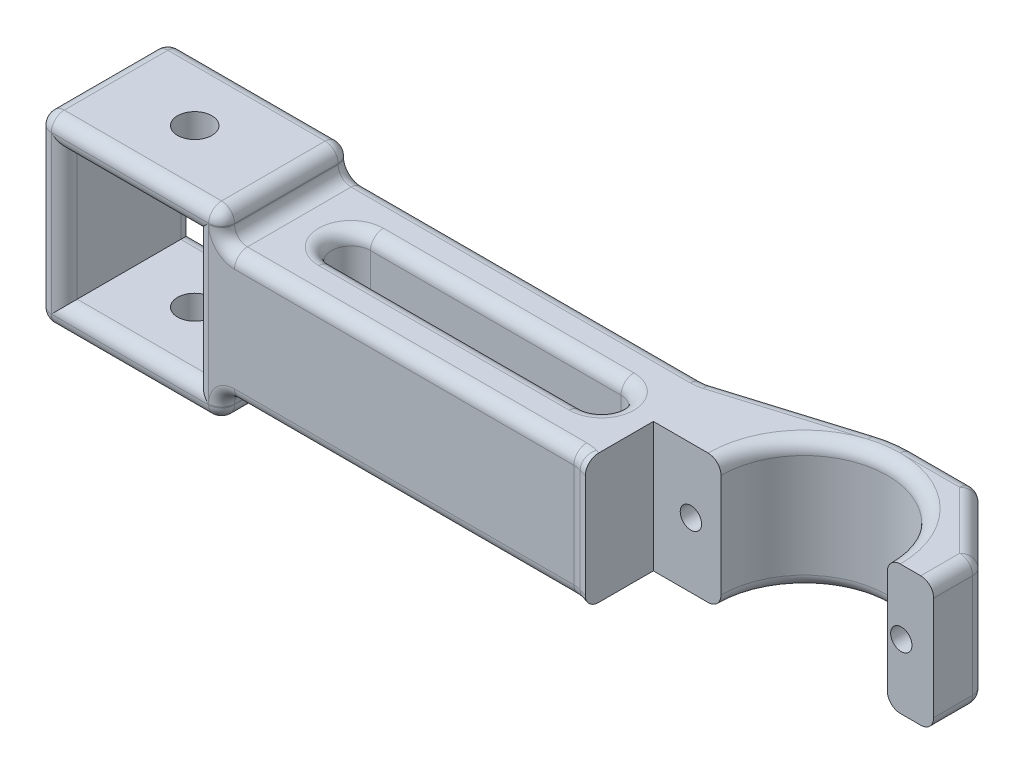
from build123d import *

# Parameters (mm, degrees)
SKETCH1_W               = 28.3
SKETCH1_H               = 28.3
SKETCH1_W_2             = 20.3
SKETCH1_H_2             = 20.3
EXTRUDE_THIN1_DEPTH     = 10
SKETCH2_W               = 55
SKETCH2_H               = 20
SKETCH2_R               = 12.85
BOSS_EXTRUDE4_DEPTH     = 10
BOSS_EXTRUDE5_DEPTH     = 10
CUT_EXTRUDE1_DEPTH      = 117.251311821
CUT_EXTRUDE1_DEPTH_BACK = 117.251311821
CUT_EXTRUDE2_DEPTH      = 117.251311821
CUT_EXTRUDE2_DEPTH_BACK = 117.251311821
SKETCH5_R               = 1.65
FILLET1_R               = 2
FILLET2_R               = 4
FILLET3_R               = 2
CUT_EXTRUDE4_DEPTH      = 119.806712773
CUT_EXTRUDE4_DEPTH_BACK = 119.806712773
SKETCH6_R               = 2.65
CUT_EXTRUDE5_START      = 6
SKETCH7_R               = 3
CUT_EXTRUDE5_DEPTH      = 20
CUT_EXTRUDE6_START      = -5
CUT_EXTRUDE6_DEPTH      = 20
CUT_EXTRUDE7_DEPTH      = 117.251311821
CUT_EXTRUDE7_DEPTH_BACK = 117.251311821
SKETCH9_W               = 43.3
SKETCH9_H               = 21.20331566
CUT_EXTRUDE8_DEPTH      = 118.887096507
CUT_EXTRUDE8_DEPTH_BACK = 118.887096507
FILLET4_R               = 2


with BuildPart() as part:
    # Sketch1 → Extrude-Thin1 (new, symmetric)
    with BuildSketch(Plane.XY):
        Rectangle(SKETCH1_W, SKETCH1_H)
        Rectangle(SKETCH1_W_2, SKETCH1_H_2, mode=Mode.SUBTRACT)
    extrude(amount=EXTRUDE_THIN1_DEPTH, both=True)

    # Sketch2 → Boss-Extrude4 (add, symmetric)
    # profile 1 of 2: a face of its own
    with BuildSketch(Plane(origin=(0, 0, 0), x_dir=(1, 0, 0), z_dir=(0, 1, 0))):
        with Locations((41.65, 0)):
            Rectangle(SKETCH2_W, SKETCH2_H)
    # profile 2 of 2: a face of its own
    with BuildSketch(Plane(origin=(0, 0, 0), x_dir=(1, 0, 0), z_dir=(0, 1, 0))):
        with BuildLine():
            Line((69.15, -10), (89.240687461, -16.118968652))
            ThreePointArc((89.240687461, -16.118968652), (111, 0), (89.240687461, 16.118968652))
            Line((89.240687461, 16.118968652), (69.15, 10))
            Line((69.15, 10), (69.15, -10))
        make_face()
        with Locations(Location((94.15, 0, 0), (0, 0, 270))):
            Circle(SKETCH2_R, mode=Mode.SUBTRACT)
    extrude(amount=BOSS_EXTRUDE4_DEPTH, both=True)

    # Sketch3 → Boss-Extrude5 (add, symmetric)
    with BuildSketch(Plane(origin=(0, 0, 0), x_dir=(1, 0, 0), z_dir=(0, 1, 0))):
        with BuildLine():
            Line((94.15, 16.85), (114.15, 16.85))
            Line((114.15, 16.85), (114.15, -16.85))
            Line((114.15, -16.85), (94.15, -16.85))
            ThreePointArc((94.15, -16.85), (111, 0), (94.15, 16.85))
        make_face()
    extrude(amount=BOSS_EXTRUDE5_DEPTH, both=True)

    # Sketch4 → Cut-Extrude1 (cut, two sides: drawn at the far end of the back side and taken through both)
    with BuildSketch(Plane.XZ.offset(-CUT_EXTRUDE1_DEPTH_BACK)):
        Polygon((104.15, 16.85), (114.15, 16.85), (114.15, 6.85), align=None)
        Polygon((114.15, -16.85), (104.15, -16.85), (114.15, -6.85), align=None)
    extrude(amount=CUT_EXTRUDE1_DEPTH + CUT_EXTRUDE1_DEPTH_BACK, mode=Mode.SUBTRACT)

    # Sketch5 → Cut-Extrude2 (cut, two sides: drawn at the far end of the back side and taken through both)
    with BuildSketch(Plane.XY.offset(-CUT_EXTRUDE2_DEPTH_BACK)):
        with Locations((109.15, 0)):
            Circle(SKETCH5_R)
        with Locations((76.65, 0)):
            Circle(SKETCH5_R)
    extrude(amount=CUT_EXTRUDE2_DEPTH + CUT_EXTRUDE2_DEPTH_BACK, mode=Mode.SUBTRACT)

    # Fillet1
    fillet1_edges = [part.edges().sort_by_distance(p)[0] for p in [
        (14.15, -10, 0),
        (14.15, 10, 0),
        (14.15, -14.15, 0),
        (-14.15, -14.15, 0),
        (-14.15, 14.15, 0),
        (14.15, 14.15, 0),
    ]]
    fillet(fillet1_edges, radius=FILLET1_R)

    # Fillet2
    fillet2_edges = [part.edges().sort_by_distance(p)[0] for p in [
        (69.15, 0, 10),
        (69.15, 0, -10),
    ]]
    fillet(fillet2_edges, radius=FILLET2_R)

    # Fillet3
    fillet3_edges = [part.edges().sort_by_distance(p)[0] for p in [
        (14.15, -12.075, -10),
        (14.15, -12.075, 10),
        (42.352185859, -10, 10),
        (42.352185859, -10, -10),
        (42.352185859, 10, -10),
        (42.352185859, 10, 10),
        (14.15, 12.075, -10),
        (14.15, 12.075, 10),
        (0, -14.15, -10),
        (-14.15, 0, -10),
        (0, 14.15, -10),
        (13.564213562, 13.564213562, -10),
        (-13.564213562, 13.564213562, -10),
        (-13.564213562, -13.564213562, -10),
        (13.564213562, -13.564213562, -10),
        (0, -14.15, 10),
        (0, 14.15, 10),
        (-14.15, 0, 10),
        (13.564213562, 13.564213562, 10),
        (-13.564213562, 13.564213562, 10),
        (-13.564213562, -13.564213562, 10),
        (13.564213562, -13.564213562, 10),
        (14.735786438, -10.585786438, 10),
        (14.735786438, -10.585786438, -10),
        (14.735786438, 10.585786438, 10),
        (14.735786438, 10.585786438, -10),
        (10.15, 0, -10),
        (0, 10.15, -10),
        (-10.15, 0, -10),
        (0, -10.15, -10),
        (10.15, 0, 10),
        (79.480237309, -10, -13.146253625),
        (79.480237309, 10, -13.146253625),
        (0, 10.15, 10),
        (79.480237309, -10, 13.146253625),
        (79.480237309, 10, 13.146253625),
        (69.143504299, -10, -10.043622515),
        (-10.15, 0, 10),
        (69.143504299, 10, -10.043622515),
        (69.143504299, -10, 10.043622515),
        (69.143504299, 10, 10.043622515),
        (0, -10.15, 10),
        (91.668279002, -10, 16.666240155),
        (94.15, 10, -12.85),
        (91.668279002, 10, 16.666240155),
        (94.15, -10, -12.85),
        (91.668279002, -10, -16.666240155),
        (91.668279002, 10, -16.666240155),
        (99.15, -10, 16.85),
        (99.15, 10, 16.85),
        (99.15, -10, -16.85),
        (99.15, 10, -16.85),
        (104.15, 0, -16.85),
        (114.15, -10, 0),
        (114.15, 10, 0),
        (114.15, 0, 6.85),
        (109.15, 10, 11.85),
        (104.15, 0, 16.85),
        (109.15, -10, 11.85),
        (109.15, 10, -11.85),
        (114.15, 0, -6.85),
        (109.15, -10, -11.85),
    ]]
    fillet(fillet3_edges, radius=FILLET3_R - 0.0001)  # a hair under: the kernel refuses the full size

    # Sketch6 → Cut-Extrude4 (cut, two sides: drawn at the far end of the back side and taken through both)
    with BuildSketch(Plane(origin=(0, 14.15, 0), x_dir=(1, 0, 0), z_dir=(0, 1, 0)).offset(-CUT_EXTRUDE4_DEPTH_BACK)):
        with Locations(Location((0, 0, 0), (0, 0, 270))):
            Circle(SKETCH6_R)
    extrude(amount=CUT_EXTRUDE4_DEPTH + CUT_EXTRUDE4_DEPTH_BACK, mode=Mode.SUBTRACT)

    # Sketch7 → Cut-Extrude5 (cut)
    with BuildSketch(Plane.XY.offset(CUT_EXTRUDE5_START)):
        with Locations((109.15, 0)):
            Circle(SKETCH7_R)
        with Locations(Location((76.65, 0, 0), (0, 0, 180))):
            Circle(SKETCH7_R)
    extrude(amount=CUT_EXTRUDE5_DEPTH, mode=Mode.SUBTRACT)

    # Sketch8 → Cut-Extrude6 (cut)
    with BuildSketch(Plane.XY.offset(CUT_EXTRUDE6_START)):
        Polygon((76.65, 3.290896534), (73.8, 1.645448267), (73.8, -1.645448267), (76.65, -3.290896534), (79.5, -1.645448267), (79.5, 1.645448267), align=None)
        Polygon((109.15, 3.290896534), (106.3, 1.645448267), (106.3, -1.645448267), (109.15, -3.290896534), (112, -1.645448267), (112, 1.645448267), align=None)
    extrude(amount=-CUT_EXTRUDE6_DEPTH, mode=Mode.SUBTRACT)

    # Sketch9 → Cut-Extrude7 (cut, two sides: drawn at the far end of the back side and taken through both)
    with BuildSketch(Plane(origin=(0, 0, 0), x_dir=(1, 0, 0), z_dir=(0, 1, 0)).offset(-CUT_EXTRUDE7_DEPTH_BACK)):
        with Locations((92.5, -10.60165783)):
            Rectangle(SKETCH9_W, SKETCH9_H)
    extrude(amount=CUT_EXTRUDE7_DEPTH + CUT_EXTRUDE7_DEPTH_BACK, mode=Mode.SUBTRACT)

    # Sketch10 → Cut-Extrude8 (cut, two sides: drawn at the far end of the back side and taken through both)
    with BuildSketch(Plane(origin=(0, 10, 0), x_dir=(1, 0, 0), z_dir=(0, 1, 0)).offset(-CUT_EXTRUDE8_DEPTH_BACK)):
        with BuildLine():
            Line((24.15, 3), (62.85, 3))
            ThreePointArc((62.85, 3), (65.85, 0), (62.85, -3))
            Line((62.85, -3), (24.15, -3))
            ThreePointArc((24.15, -3), (21.15, 0), (24.15, 3))
        make_face()
    extrude(amount=CUT_EXTRUDE8_DEPTH + CUT_EXTRUDE8_DEPTH_BACK, mode=Mode.SUBTRACT)

    # Fillet4
    fillet4_edges = [part.edges().sort_by_distance(p)[0] for p in [
        (43.5, -10, 3),
        (65.85, -10, 0),
        (43.5, -10, -3),
        (21.15, -10, 0),
        (21.15, 10, 0),
        (43.5, 10, -3),
        (65.85, 10, 0),
        (43.5, 10, 3),
    ]]
    fillet(fillet4_edges, radius=FILLET4_R)


solid = part.part
